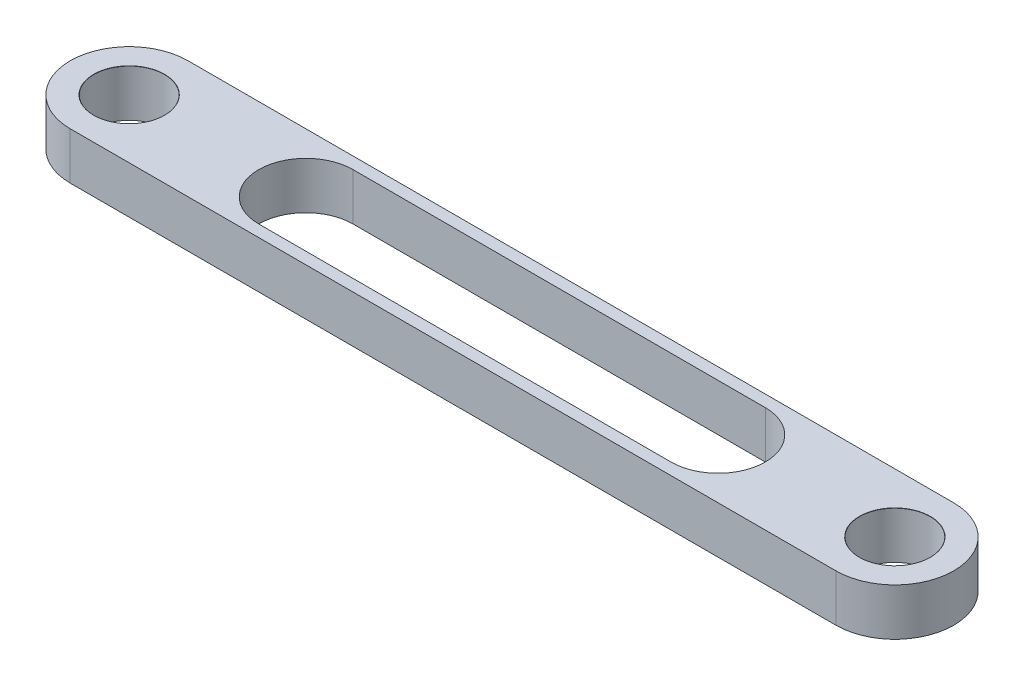
from build123d import *

# Parameters (mm, degrees)
BOSS_EXTRU_1_DEPTH          = 4
D_GAGEMENT_M101_D           = 12
D_GAGEMENT_M101_CSINK_D     = 12.05
D_GAGEMENT_M101_CSINK_ANGLE = 90


with BuildPart() as part:
    # Esquisse1 → Boss.-Extru.1 (new, symmetric)
    with BuildSketch(Plane(origin=(0, 0, 0), x_dir=(1, 0, 0), z_dir=(0, 1, 0))):
        with BuildLine():
            Line((0, 10), (130, 10))
            ThreePointArc((130, 10), (140, 0), (130, -10))
            Line((130, -10), (0, -10))
            ThreePointArc((0, -10), (-10, 0), (0, 10))
        make_face()
        with BuildLine():
            Line((30, 8), (100, 8))
            ThreePointArc((100, 8), (108, 0), (100, -8))
            Line((100, -8), (30, -8))
            ThreePointArc((30, -8), (22, 0), (30, 8))
        make_face(mode=Mode.SUBTRACT)
    extrude(amount=BOSS_EXTRU_1_DEPTH, both=True)

    # Dégagement M101 (through all)
    with Locations(Plane(origin=(0, 4, 0), x_dir=(1, 0, 0), z_dir=(0, 1, 0))):
        with Locations((130, 0), (0, 0)):
            CounterSinkHole(D_GAGEMENT_M101_D / 2, D_GAGEMENT_M101_CSINK_D / 2, counter_sink_angle=D_GAGEMENT_M101_CSINK_ANGLE)


solid = part.part
